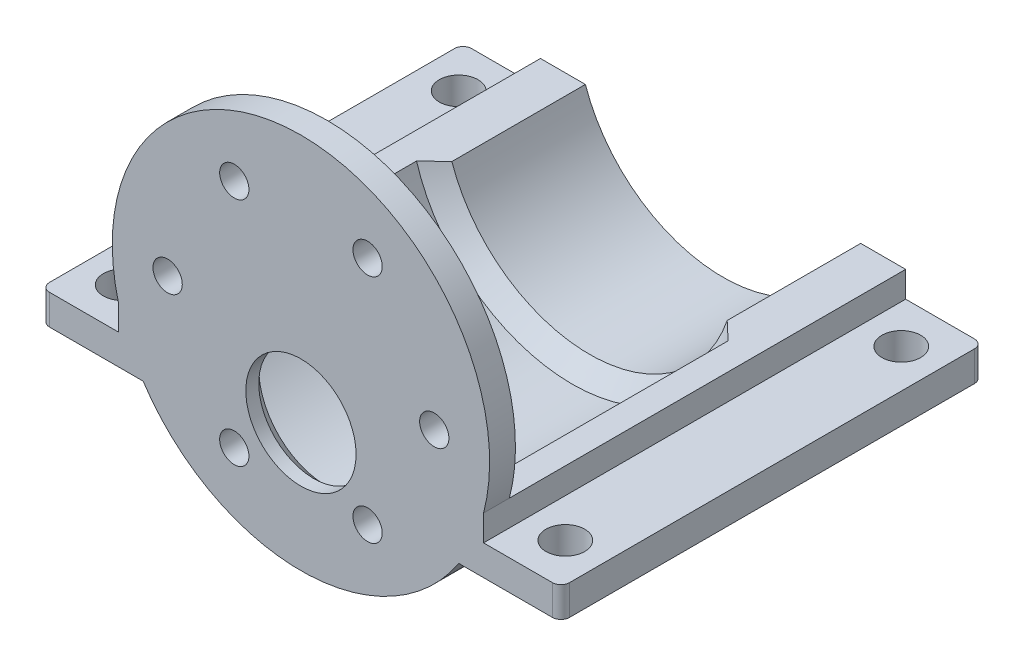
from build123d import *
from build123d.topology import SkipClean

# Parameters (mm, degrees)
BOSS_EXTRUDE1_START     = 94
SKETCH1_R               = 21.9
SKETCH1_R_2             = 1.7
SKETCH1_R_3             = 6.4
BOSS_EXTRUDE1_DEPTH     = 3
BOSS_EXTRUDE2_START     = 91
BOSS_EXTRUDE2_DEPTH     = 27.5
BOSS_EXTRUDE3_START     = 45
BOSS_EXTRUDE3_DEPTH     = 18.5
BOSS_EXTRUDE7_START     = 94
BOSS_EXTRUDE7_DEPTH     = 49
CUT_EXTRUDE5_DEPTH      = 104.301419283
CUT_EXTRUDE5_DEPTH_BACK = 104.301419283
SKETCH4_R               = 2.25
CHAMFER3_SIZE           = 3
CHAMFER4_SIZE           = 1.5
FILLET2_R               = 1


with BuildPart() as part:
    # Sketch1 → Boss-Extrude1 (new body)
    with BuildSketch(Plane.XY.offset(BOSS_EXTRUDE1_START)):
        Circle(SKETCH1_R)
        with Locations((15.475, 0)):
            Circle(SKETCH1_R_2, mode=Mode.SUBTRACT)
        with Locations((7.7375, -13.401743124)):
            Circle(SKETCH1_R_2, mode=Mode.SUBTRACT)
        with Locations((-7.7375, -13.401743124)):
            Circle(SKETCH1_R_2, mode=Mode.SUBTRACT)
        with Locations((-15.475, 0)):
            Circle(SKETCH1_R_2, mode=Mode.SUBTRACT)
        with Locations((-7.7375, 13.401743124)):
            Circle(SKETCH1_R_2, mode=Mode.SUBTRACT)
        with Locations((7.7375, 13.401743124)):
            Circle(SKETCH1_R_2, mode=Mode.SUBTRACT)
        with Locations((0, -7)):
            Circle(SKETCH1_R_3, mode=Mode.SUBTRACT)
    extrude(amount=-BOSS_EXTRUDE1_DEPTH)

    # Sketch1<5> → Boss-Extrude2 (add)
    with BuildSketch(Plane.XY.offset(BOSS_EXTRUDE2_START)):
        with BuildLine():
            ThreePointArc((18.319661569, -12), (19.330787418, -10.292262036), (20.183161298, -8.5))
            Line((20.183161298, -8.5), (16.880758277, -8.5))
            ThreePointArc((16.880758277, -8.5), (0, -18.9), (-16.880758277, -8.5))
            Line((-16.880758277, -8.5), (-20.183161298, -8.5))
            ThreePointArc((-20.183161298, -8.5), (-19.330787418, -10.292262036), (-18.319661569, -12))
            ThreePointArc((-18.319661569, -12), (0, -21.9), (18.319661569, -12))
        make_face()
        with BuildLine():
            Line((-20.183161298, -8.5), (-16.880758277, -8.5))
            ThreePointArc((-16.880758277, -8.5), (-17.545632887, -7.025721786), (-18.082035284, -5.5))
            Line((-18.082035284, -5.5), (-21.198113124, -5.5))
            ThreePointArc((-21.198113124, -5.5), (-20.744938375, -7.018371022), (-20.183161298, -8.5))
        make_face()
        with BuildLine():
            Line((16.880758277, -8.5), (20.183161298, -8.5))
            ThreePointArc((20.183161298, -8.5), (20.744938375, -7.018371022), (21.198113124, -5.5))
            Line((21.198113124, -5.5), (18.082035284, -5.5))
            ThreePointArc((18.082035284, -5.5), (17.545632887, -7.025721786), (16.880758277, -8.5))
        make_face()
    extrude(amount=-BOSS_EXTRUDE2_DEPTH)

    # Sketch1<6> → Boss-Extrude3 (add)
    with SkipClean():  # the faces are left unmerged after this step: merging them gives an invalid solid
        with BuildSketch(Plane.XY.offset(BOSS_EXTRUDE3_START)):
            with BuildLine():
                Line((21.198113124, -5.5), (15.979987484, -5.5))
                ThreePointArc((15.979987484, -5.5), (0, -16.9), (-15.979987484, -5.5))
                Line((-15.979987484, -5.5), (-21.198113124, -5.5))
                ThreePointArc((-21.198113124, -5.5), (0, -21.9), (21.198113124, -5.5))
            make_face()
        extrude(amount=BOSS_EXTRUDE3_DEPTH)

    # Sketch1<11> → Boss-Extrude7 (add)
    with SkipClean():  # the faces are left unmerged after this step: merging them gives an invalid solid
        with BuildSketch(Plane.XY.offset(BOSS_EXTRUDE7_START)):
            with BuildLine():
                ThreePointArc((21.198113124, -5.5), (20.024388359, -8.867574124), (18.319661569, -12))
                Line((18.319661569, -12), (30.183161298, -12))
                Line((30.183161298, -12), (30.183161298, -8.5))
                Line((30.183161298, -8.5), (21.198113124, -8.5))
                Line((21.198113124, -8.5), (21.198113124, -5.5))
            make_face()
            with BuildLine():
                Line((-30.183161298, -12), (-18.319661569, -12))
                ThreePointArc((-18.319661569, -12), (-20.024388359, -8.867574124), (-21.198113124, -5.5))
                Line((-21.198113124, -5.5), (-21.198113124, -8.5))
                Line((-21.198113124, -8.5), (-30.183161298, -8.5))
                Line((-30.183161298, -8.5), (-30.183161298, -12))
            make_face()
        extrude(amount=-BOSS_EXTRUDE7_DEPTH)

    # Sketch4 → Cut-Extrude5 (cut, two sides: drawn at the far end of the back side and taken through both)
    with SkipClean():  # the faces are left unmerged after this step: merging them gives an invalid solid
        with BuildSketch(Plane(origin=(0, -8.5, 0), x_dir=(1, 0, 0), z_dir=(0, 1, 0)).offset(-CUT_EXTRUDE5_DEPTH_BACK)):
            with Locations(Location((-25.690637211, -50, 0), (0, 0, 270))):
                Circle(SKETCH4_R)
            with Locations(Location((-25.690637211, -89, 0), (0, 0, 270))):
                Circle(SKETCH4_R)
            with Locations(Location((25.690637211, -50, 0), (0, 0, 270))):
                Circle(SKETCH4_R)
            with Locations(Location((25.690637211, -89, 0), (0, 0, 270))):
                Circle(SKETCH4_R)
        extrude(amount=CUT_EXTRUDE5_DEPTH + CUT_EXTRUDE5_DEPTH_BACK, mode=Mode.SUBTRACT)

    # Chamfer3
    # the kernel refuses this chamfer: 3 mm, written as the material it takes off along each edge
    with BuildSketch(Plane(origin=(0, 0, 63.5), x_dir=(0.9921367643584464, 0.1251584627915844, 0), z_dir=(-0.1251584627915844, 0.9921367643584464, 0))) as chamfer3_piece_1_section:
        Polygon((16.9 + CHAMFER3_SIZE, 0), (16.9, CHAMFER3_SIZE), (16.9, 0), align=None)
    chamfer3_piece_1 = revolve(axis=Axis((0, 0, 63.5), (0, 0, -1)), revolution_arc=194.379813793, mode=Mode.PRIVATE)
    chamfer3_piece_1 = chamfer3_piece_1 & Plane(origin=(0, 0, 61.502732277), x_dir=(0.8931618135876879, -0.4497354497354555, 0), z_dir=(0, 0, 1)) * Cylinder(18.9, 80, mode=Mode.PRIVATE)
    add(chamfer3_piece_1, mode=Mode.SUBTRACT)

    # Chamfer4
    chamfer4_edges = [part.edges().sort_by_distance(p)[0] for p in [
        (-6.4, -7, 91),
    ]]
    chamfer(chamfer4_edges, length=CHAMFER4_SIZE)

    # Fillet2
    fillet2_edges = [part.edges().sort_by_distance(p)[0] for p in [
        (-30.183161298, -10.25, 45),
        (-30.183161298, -10.25, 94),
        (30.183161298, -10.25, 45),
        (30.183161298, -10.25, 94),
    ]]
    fillet(fillet2_edges, radius=FILLET2_R)


solid = part.part
